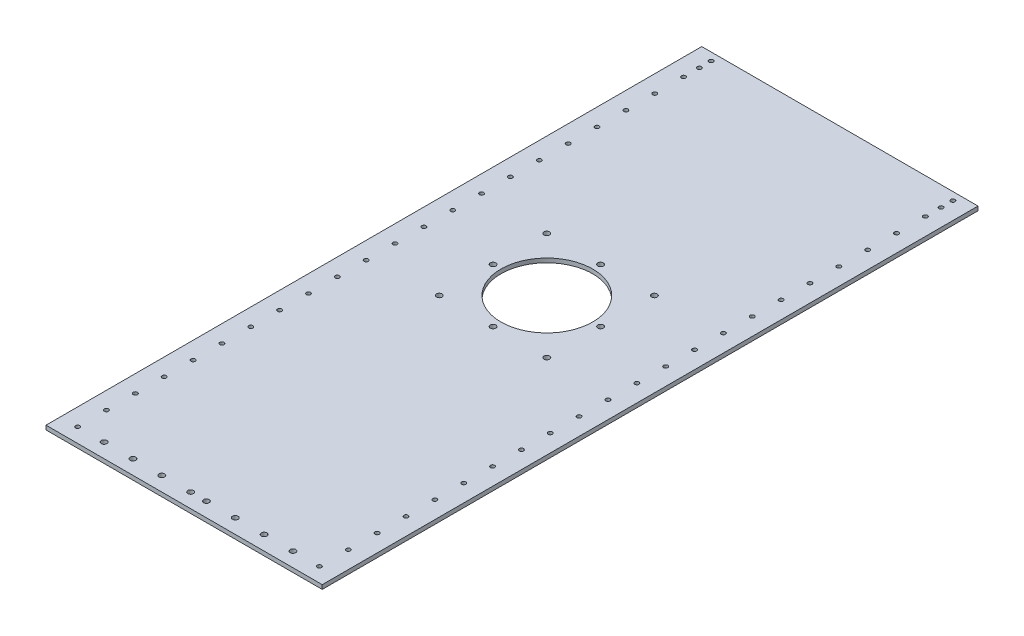
from build123d import *

# Parameters (mm, degrees)
SKETCH1_W           = 210.61
SKETCH1_H           = 500
SKETCH1_R           = 1.6
SKETCH1_R_2         = 2.125
SKETCH1_R_3         = 35
BOSS_EXTRUDE1_DEPTH = 3.175


with BuildPart() as part:
    # Sketch1 → Boss-Extrude1 (new body)
    with BuildSketch(Plane(origin=(0, 0, 0), x_dir=(1, 0, 0), z_dir=(0, 1, 0))):
        Rectangle(SKETCH1_W, SKETCH1_H)
        with Locations((92.18, 244)):
            Circle(SKETCH1_R, mode=Mode.SUBTRACT)
        with Locations((92.18, 235)):
            Circle(SKETCH1_R, mode=Mode.SUBTRACT)
        with Locations((92.18, 223)):
            Circle(SKETCH1_R, mode=Mode.SUBTRACT)
        with Locations((92.18, 201)):
            Circle(SKETCH1_R, mode=Mode.SUBTRACT)
        with Locations((92.18, 179)):
            Circle(SKETCH1_R, mode=Mode.SUBTRACT)
        with Locations((92.18, 157)):
            Circle(SKETCH1_R, mode=Mode.SUBTRACT)
        with Locations((92.18, 135)):
            Circle(SKETCH1_R, mode=Mode.SUBTRACT)
        with Locations((92.18, 113)):
            Circle(SKETCH1_R, mode=Mode.SUBTRACT)
        with Locations((92.18, 91)):
            Circle(SKETCH1_R, mode=Mode.SUBTRACT)
        with Locations((92.18, 69)):
            Circle(SKETCH1_R, mode=Mode.SUBTRACT)
        with Locations((92.18, 47)):
            Circle(SKETCH1_R, mode=Mode.SUBTRACT)
        with Locations((92.18, 25)):
            Circle(SKETCH1_R, mode=Mode.SUBTRACT)
        with Locations((92.18, 3)):
            Circle(SKETCH1_R, mode=Mode.SUBTRACT)
        with Locations((92.18, -19)):
            Circle(SKETCH1_R, mode=Mode.SUBTRACT)
        with Locations((92.18, -41)):
            Circle(SKETCH1_R, mode=Mode.SUBTRACT)
        with Locations((92.18, -63)):
            Circle(SKETCH1_R, mode=Mode.SUBTRACT)
        with Locations((92.18, -85)):
            Circle(SKETCH1_R, mode=Mode.SUBTRACT)
        with Locations((92.18, -107)):
            Circle(SKETCH1_R, mode=Mode.SUBTRACT)
        with Locations((92.18, -129)):
            Circle(SKETCH1_R, mode=Mode.SUBTRACT)
        with Locations((92.18, -151)):
            Circle(SKETCH1_R, mode=Mode.SUBTRACT)
        with Locations((92.18, -173)):
            Circle(SKETCH1_R, mode=Mode.SUBTRACT)
        with Locations((92.18, -195)):
            Circle(SKETCH1_R, mode=Mode.SUBTRACT)
        with Locations((92.18, -217)):
            Circle(SKETCH1_R, mode=Mode.SUBTRACT)
        with Locations((92.18, -239)):
            Circle(SKETCH1_R, mode=Mode.SUBTRACT)
        with Locations((-92.18, 69)):
            Circle(SKETCH1_R, mode=Mode.SUBTRACT)
        with Locations((-92.18, 91)):
            Circle(SKETCH1_R, mode=Mode.SUBTRACT)
        with Locations((-92.18, 113)):
            Circle(SKETCH1_R, mode=Mode.SUBTRACT)
        with Locations((-92.18, 135)):
            Circle(SKETCH1_R, mode=Mode.SUBTRACT)
        with Locations((-92.18, 157)):
            Circle(SKETCH1_R, mode=Mode.SUBTRACT)
        with Locations((-92.18, 179)):
            Circle(SKETCH1_R, mode=Mode.SUBTRACT)
        with Locations((-92.18, 201)):
            Circle(SKETCH1_R, mode=Mode.SUBTRACT)
        with Locations((-92.18, 223)):
            Circle(SKETCH1_R, mode=Mode.SUBTRACT)
        with Locations((-92.18, 235)):
            Circle(SKETCH1_R, mode=Mode.SUBTRACT)
        with Locations((-92.18, -239)):
            Circle(SKETCH1_R, mode=Mode.SUBTRACT)
        with Locations((-92.18, -217)):
            Circle(SKETCH1_R, mode=Mode.SUBTRACT)
        with Locations((-92.18, -195)):
            Circle(SKETCH1_R, mode=Mode.SUBTRACT)
        with Locations((-92.18, -173)):
            Circle(SKETCH1_R, mode=Mode.SUBTRACT)
        with Locations((-92.18, -151)):
            Circle(SKETCH1_R, mode=Mode.SUBTRACT)
        with Locations((-92.18, -129)):
            Circle(SKETCH1_R, mode=Mode.SUBTRACT)
        with Locations((-92.18, -107)):
            Circle(SKETCH1_R, mode=Mode.SUBTRACT)
        with Locations((-92.18, -85)):
            Circle(SKETCH1_R, mode=Mode.SUBTRACT)
        with Locations((-92.18, -63)):
            Circle(SKETCH1_R, mode=Mode.SUBTRACT)
        with Locations((-92.18, -41)):
            Circle(SKETCH1_R, mode=Mode.SUBTRACT)
        with Locations((-92.18, -19)):
            Circle(SKETCH1_R, mode=Mode.SUBTRACT)
        with Locations((-92.18, 3)):
            Circle(SKETCH1_R, mode=Mode.SUBTRACT)
        with Locations((-92.18, 25)):
            Circle(SKETCH1_R, mode=Mode.SUBTRACT)
        with Locations((-92.18, 47)):
            Circle(SKETCH1_R, mode=Mode.SUBTRACT)
        with Locations((-92.18, 244)):
            Circle(SKETCH1_R, mode=Mode.SUBTRACT)
        with Locations((6, -239)):
            Circle(SKETCH1_R_2, mode=Mode.SUBTRACT)
        with Locations((28, -239)):
            Circle(SKETCH1_R_2, mode=Mode.SUBTRACT)
        with Locations((50, -239)):
            Circle(SKETCH1_R_2, mode=Mode.SUBTRACT)
        with Locations((72, -239)):
            Circle(SKETCH1_R_2, mode=Mode.SUBTRACT)
        with Locations((-72, -239)):
            Circle(SKETCH1_R_2, mode=Mode.SUBTRACT)
        with Locations((-50, -239)):
            Circle(SKETCH1_R_2, mode=Mode.SUBTRACT)
        with Locations((-28, -239)):
            Circle(SKETCH1_R_2, mode=Mode.SUBTRACT)
        with Locations((-6, -239)):
            Circle(SKETCH1_R_2, mode=Mode.SUBTRACT)
        with Locations((0, 26.549)):
            Circle(SKETCH1_R_3, mode=Mode.SUBTRACT)
        with Locations((41, 26.549)):
            Circle(SKETCH1_R_2, mode=Mode.SUBTRACT)
        with Locations((0, 67.549)):
            Circle(SKETCH1_R_2, mode=Mode.SUBTRACT)
        with Locations((41, 67.549)):
            Circle(SKETCH1_R_2, mode=Mode.SUBTRACT)
        with Locations((-41, 26.549)):
            Circle(SKETCH1_R_2, mode=Mode.SUBTRACT)
        with Locations((-41, 67.549)):
            Circle(SKETCH1_R_2, mode=Mode.SUBTRACT)
        with Locations((41, -14.451)):
            Circle(SKETCH1_R_2, mode=Mode.SUBTRACT)
        with Locations((0, -14.451)):
            Circle(SKETCH1_R_2, mode=Mode.SUBTRACT)
        with Locations((-41, -14.451)):
            Circle(SKETCH1_R_2, mode=Mode.SUBTRACT)
    extrude(amount=BOSS_EXTRUDE1_DEPTH)


solid = part.part
